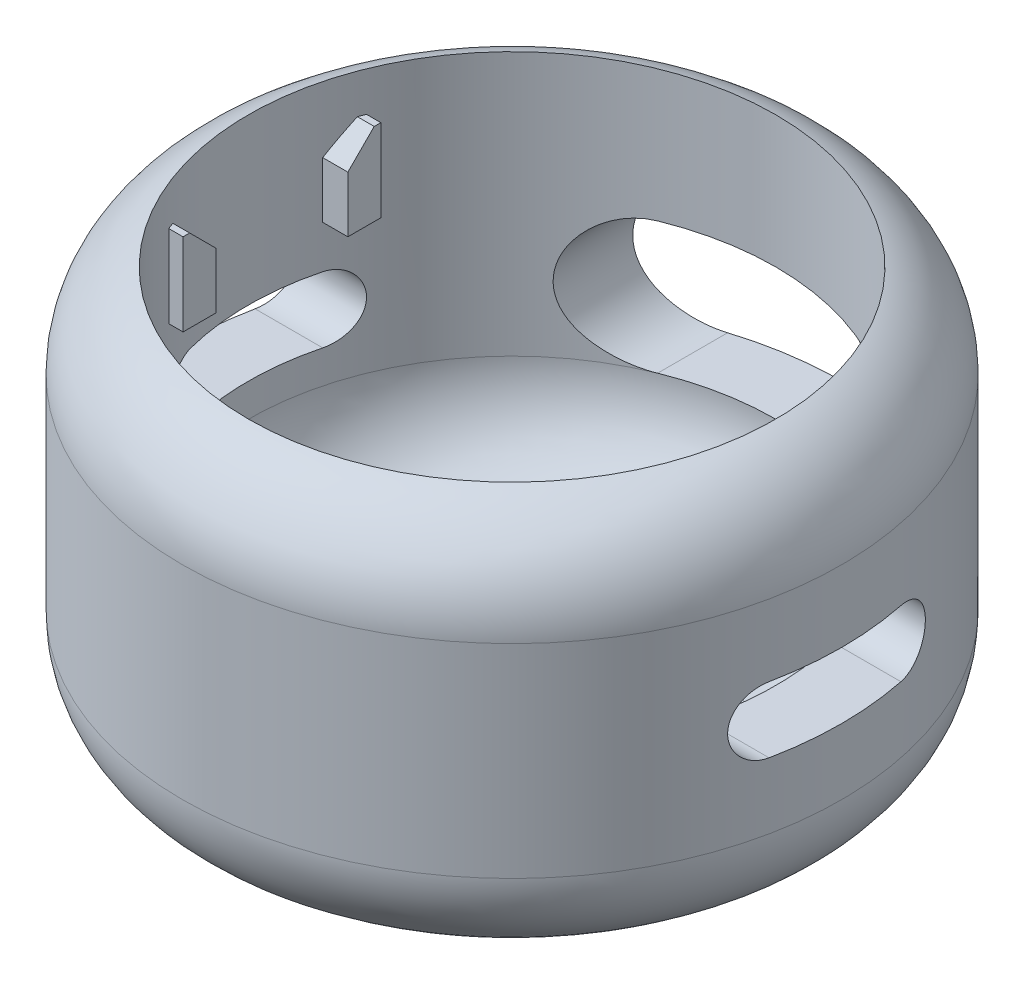
from build123d import *

# Parameters (mm, degrees)
SKETCH_1_R               = 10
EXTRUDE_1_DEPTH          = 12
CUT_EXTRUDE_1_DEPTH      = 23.353389068
SKETCH_3_R               = 8
CUT_EXTRUDE_2_DEPTH      = 11
FILLET_1_R               = 3
CUT_EXTRUDE_3_DEPTH      = 23.353389241
CUT_EXTRUDE_3_DEPTH_BACK = 23.353389241
SKETCH_5_W               = 1.508883289
SKETCH_5_H               = 1
SKETCH_5_H_2             = 0.980176719
SKETCH_5_W_2             = 1.789126732
EXTRUDE_3_DEPTH          = 2.5
CHAMFER_2_SIZE           = 0.8


with BuildPart() as part:
    # 草图1 → 凸台-拉伸1 (new body)
    with BuildSketch(Plane(origin=(0, 0, 0), x_dir=(1, 0, 0), z_dir=(0, 1, 0))):
        with Locations(Location((3.877687805, 2.770426149, 0), (0, 0, 270))):
            Circle(SKETCH_1_R)
    extrude(amount=EXTRUDE_1_DEPTH)

    # 草图2 → 切除-拉伸1 (cut, through all)
    with BuildSketch(Plane.XY):
        with BuildLine():
            Line((0.877687805, 8), (6.877687805, 8))
            ThreePointArc((6.877687805, 8), (8.877687805, 6), (6.877687805, 4))
            Line((6.877687805, 4), (0.877687805, 4))
            ThreePointArc((0.877687805, 4), (-1.122312195, 6), (0.877687805, 8))
        make_face()
    extrude(amount=-CUT_EXTRUDE_1_DEPTH, mode=Mode.SUBTRACT)

    # 草图3 → 切除-拉伸2 (cut)
    with BuildSketch(Plane(origin=(0, 12, 0), x_dir=(1, 0, 0), z_dir=(0, 1, 0))):
        with Locations(Location((3.877687805, 2.770426149, 0), (0, 0, 270))):
            Circle(SKETCH_3_R)
    extrude(amount=-CUT_EXTRUDE_2_DEPTH, mode=Mode.SUBTRACT)

    # 圆角1
    # the kernel refuses this fillet: 3 mm, written as the material it adds along each edge
    with BuildSketch(Plane(origin=(3.877687805, 1, -2.770426149), x_dir=(0, 0, 1), z_dir=(-1, 0, 0))) as fillet_1_piece_1:
        with BuildLine():
            CenterArc((8 - FILLET_1_R, FILLET_1_R), FILLET_1_R, 270, 90)
            Line((8 - FILLET_1_R, 0), (8, 0))
            Line((8, 0), (8, FILLET_1_R))
        make_face()
    revolve(axis=Axis((3.877687805, 1, -2.770426149), (0, 1, 0)))
    # the kernel refuses this fillet: 3 mm, written as the material it takes off along each edge
    with BuildSketch(Plane(origin=(3.877687805, 0, -2.770426149), x_dir=(0, 0, 1), z_dir=(-1, 0, 0))) as fillet_1_2_piece_1:
        with BuildLine():
            CenterArc((10 - FILLET_1_R, FILLET_1_R), FILLET_1_R, 270, 90)
            Line((10 - FILLET_1_R, 0), (10, 0))
            Line((10, 0), (10, FILLET_1_R))
        make_face()
    revolve(axis=Axis((3.877687805, 0, -2.770426149), (0, 1, 0)), mode=Mode.SUBTRACT)
    with BuildSketch(Plane(origin=(3.877687805, 12, -2.770426149), x_dir=(0, 0, 1), z_dir=(-1, 0, 0))) as fillet_1_2_piece_2:
        with BuildLine():
            CenterArc((7, -2.828427125), FILLET_1_R, 0, 70.528779366)
            Line((8, 0), (10, 0))
            Line((10, 0), (10, -2.828427125))
        make_face()
    revolve(axis=Axis((3.877687805, 12, -2.770426149), (0, 1, 0)), mode=Mode.SUBTRACT)

    # 草图4 → 切除-拉伸3 (cut, two sides: drawn at the far end of the back side and taken through both)
    with BuildSketch(Plane(origin=(0, 0, 0), x_dir=(0, 0, -1), z_dir=(1, 0, 0)).offset(-CUT_EXTRUDE_3_DEPTH_BACK)):
        with BuildLine():
            Line((0.770426149, 7), (4.770426149, 7))
            ThreePointArc((4.770426149, 7), (5.770426149, 6), (4.770426149, 5))
            Line((4.770426149, 5), (0.770426149, 5))
            ThreePointArc((0.770426149, 5), (-0.229573851, 6), (0.770426149, 7))
        make_face()
    extrude(amount=CUT_EXTRUDE_3_DEPTH + CUT_EXTRUDE_3_DEPTH_BACK, mode=Mode.SUBTRACT)

    # 草图5 → 凸台-拉伸3 (add)
    with BuildSketch(Plane(origin=(0, 10.8, 0), x_dir=(-1, 0, 0), z_dir=(0, -1, 0))):
        with Locations((-11.601062589, 5.270426149)):
            Rectangle(SKETCH_5_W, SKETCH_5_H)
        with Locations((-11.601062589, 0.280337789)):
            Rectangle(SKETCH_5_W, SKETCH_5_H_2)
        with Locations((3.999711661, 5.270426149)):
            Rectangle(SKETCH_5_W_2, SKETCH_5_H)
        with Locations((3.999711661, 0.270426149)):
            Rectangle(SKETCH_5_W_2, SKETCH_5_H)
    extrude(amount=EXTRUDE_3_DEPTH)

    # 倒角2
    chamfer_2_edges = [part.edges().sort_by_distance(p)[0] for p in [
        (11.235137721, 10.8, -0.770426149),
        (-3.486713591, 10.8, -4.770426149),
        (-3.486713591, 10.8, -0.770426149),
        (11.235137721, 10.8, -4.770426149),
    ]]
    chamfer(chamfer_2_edges, length=CHAMFER_2_SIZE)


solid = part.part
